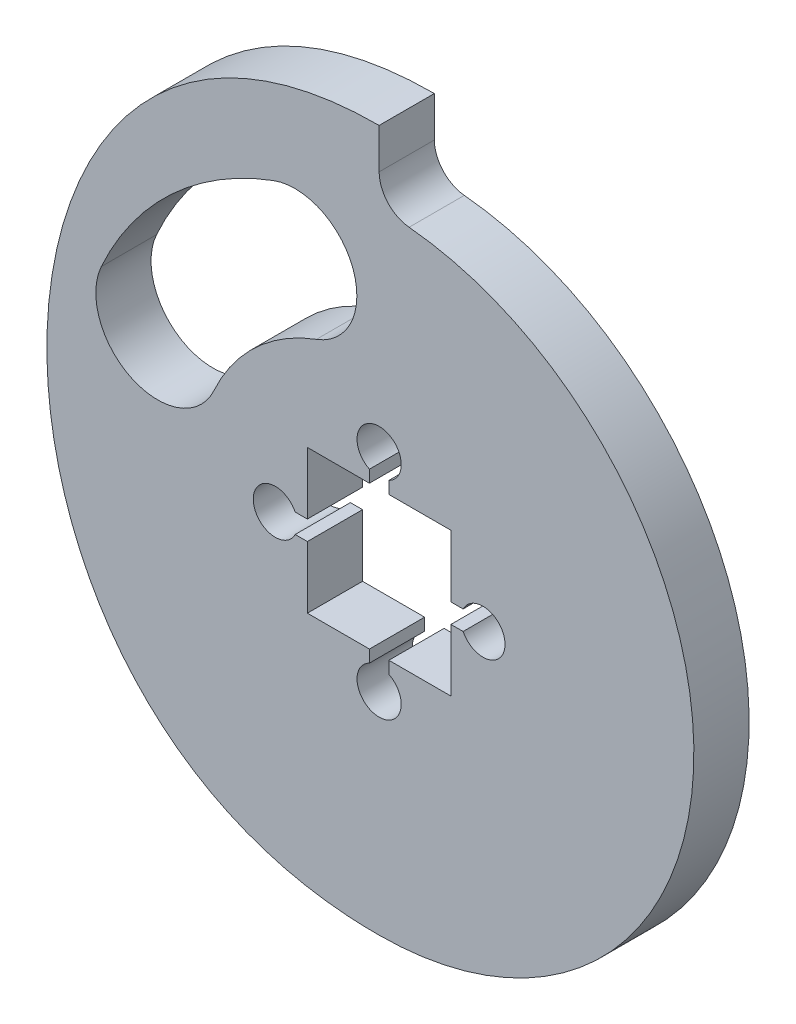
from build123d import *

# Parameters (mm, degrees)
BOSS_EXTRUDE1_DEPTH = 6.35
CUT_EXTRUDE1_DEPTH  = 59.957513028
FILLET2_R           = 3.81


with BuildPart() as part:
    # Sketch1 → Boss-Extrude1 (new body)
    with BuildSketch(Plane.XY):
        with BuildLine():
            Line((0, 36.195), (0, 44.45))
            add(Edge.make_bspline(
                [(0, 44.45), (-26.600153249, 44.45), (-51.052298523, 0.651036056), (-24.15519568, -36.349078787), (0, -36.195)],
                knots=[0, 0, 0, 0, 0.529165327, 1, 1, 1, 1], degree=3))
            ThreePointArc((0, -36.195), (36.195, 0), (0, 36.195))
        make_face()
        with BuildLine():
            Line((8.255, -8.255), (1.1176, -8.255))
            Line((1.1176, -8.255), (1.1176, -9.657085657))
            ThreePointArc((1.1176, -9.657085657), (0, -14.478), (-1.1176, -9.657085657))
            Line((-1.1176, -9.657085657), (-1.1176, -8.255))
            Line((-1.1176, -8.255), (-8.255, -8.255))
            Line((-8.255, -8.255), (-8.255, -1.1176))
            Line((-8.255, -1.1176), (-9.657085657, -1.1176))
            ThreePointArc((-9.657085657, -1.1176), (-14.478, 0), (-9.657085657, 1.1176))
            Line((-9.657085657, 1.1176), (-8.255, 1.1176))
            Line((-8.255, 1.1176), (-8.255, 8.255))
            Line((-8.255, 8.255), (-1.1176, 8.255))
            Line((-1.1176, 8.255), (-1.1176, 9.657085657))
            ThreePointArc((-1.1176, 9.657085657), (0, 14.478), (1.1176, 9.657085657))
            Line((1.1176, 9.657085657), (1.1176, 8.255))
            Line((1.1176, 8.255), (8.255, 8.255))
            Line((8.255, 8.255), (8.255, 1.1176))
            Line((8.255, 1.1176), (9.657085657, 1.1176))
            ThreePointArc((9.657085657, 1.1176), (14.478, 0), (9.657085657, -1.1176))
            Line((9.657085657, -1.1176), (8.255, -1.1176))
            Line((8.255, -1.1176), (8.255, -8.255))
        make_face(mode=Mode.SUBTRACT)
    extrude(amount=BOSS_EXTRUDE1_DEPTH)

    # Sketch5 → Cut-Extrude1 (cut, through all)
    with BuildSketch(Plane.XY.offset(6.35)):
        with BuildLine():
            ThreePointArc((-12.136378722, 32.883902073), (-23.899090909, 25.641297895), (-31.950108913, 14.416422734))
            ThreePointArc((-31.950108913, 14.416422734), (-28.392549398, 5.00872066), (-18.984847325, 8.566280175))
            ThreePointArc((-18.984847325, 8.566280175), (-14.200909091, 15.236133532), (-7.211471414, 19.539709927))
            ThreePointArc((-7.211471414, 19.539709927), (-3.001828995, 28.674259654), (-12.136378722, 32.883902073))
        make_face()
    extrude(amount=-CUT_EXTRUDE1_DEPTH, mode=Mode.SUBTRACT)

    # Fillet2
    fillet2_edges = [part.edges().sort_by_distance(p)[0] for p in [
        (0, 36.195, 3.175),
    ]]
    fillet(fillet2_edges, radius=FILLET2_R)


solid = part.part
